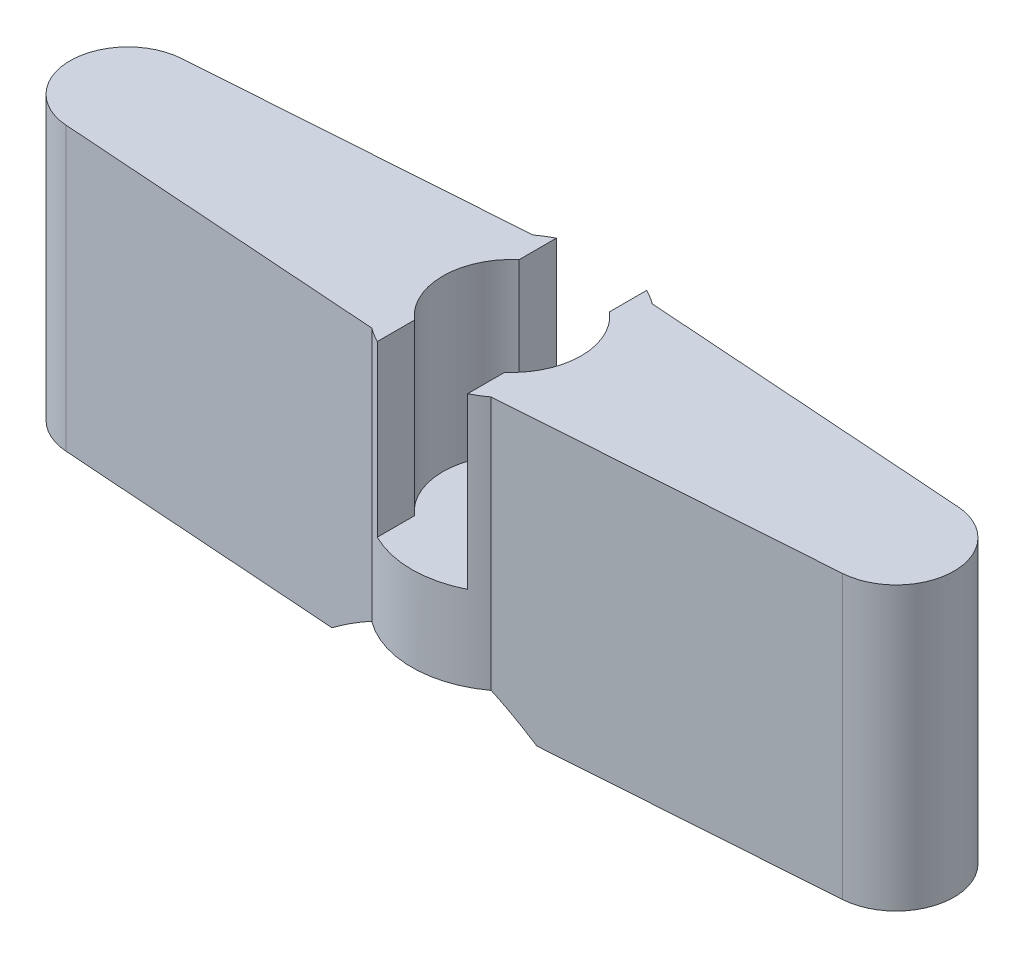
from build123d import *

# Parameters (mm, degrees)
BOSS_EXTRUDE1_DEPTH = 10
CUT_EXTRUDE1_DEPTH  = 1
CHAMFER1_SIZE       = 1
CUT_EXTRUDE2_DEPTH  = 6


with BuildPart() as part:
    # Sketch2 → Boss-Extrude1 (new body)
    with BuildSketch(Plane(origin=(0, 0, 0), x_dir=(1, 0, 0), z_dir=(0, 1, 0))):
        with BuildLine():
            Line((-13.742133053, -2.045066795), (-2.112067201, -2.853361551))
            ThreePointArc((-2.112067201, -2.853361551), (0, -3.55), (2.112067201, -2.853361551))
            Line((2.112067201, -2.853361551), (13.742133053, -2.045066795))
            ThreePointArc((13.742133053, -2.045066795), (15.65, 0), (13.742133053, 2.045066795))
            Line((13.742133053, 2.045066795), (2.112067201, 2.853361551))
            ThreePointArc((2.112067201, 2.853361551), (0, 3.55), (-2.112067201, 2.853361551))
            Line((-2.112067201, 2.853361551), (-13.742133053, 2.045066795))
            ThreePointArc((-13.742133053, 2.045066795), (-15.65, 0), (-13.742133053, -2.045066795))
        make_face()
    extrude(amount=BOSS_EXTRUDE1_DEPTH)

    # Sketch3 → Cut-Extrude1 (cut)
    with BuildSketch(Plane.XZ):
        with BuildLine():
            ThreePointArc((-2.112067201, 2.853361551), (0, -3.55), (2.112067201, 2.853361551))
            ThreePointArc((2.112067201, 2.853361551), (0, 3.55), (-2.112067201, 2.853361551))
        make_face()
    extrude(amount=-CUT_EXTRUDE1_DEPTH, mode=Mode.SUBTRACT)

    # Chamfer1
    chamfer1_edges = [part.edges().sort_by_distance(p)[0] for p in [
        (3.55, 0, 0),
        (-3.55, 0, 0),
    ]]
    chamfer(chamfer1_edges, length=CHAMFER1_SIZE - 0.0001)  # a hair under: the kernel refuses the full size

    # Shaft Key → Cut-Extrude2 (cut)
    with BuildSketch(Plane(origin=(0, 10, 0), x_dir=(1, 0, 0), z_dir=(0, 1, 0))):
        with BuildLine():
            Line((1.6, -1.855397532), (1.6, -5.45))
            Line((1.6, -5.45), (-1.6, -5.45))
            Line((-1.6, -5.45), (-1.6, -1.855397532))
            ThreePointArc((-1.6, -1.855397532), (-2.45, 0), (-1.6, 1.855397532))
            Line((-1.6, 1.855397532), (-1.6, 5.45))
            Line((-1.6, 5.45), (1.6, 5.45))
            Line((1.6, 5.45), (1.6, 1.855397532))
            ThreePointArc((1.6, 1.855397532), (2.45, 0), (1.6, -1.855397532))
        make_face()
    extrude(amount=-CUT_EXTRUDE2_DEPTH, mode=Mode.SUBTRACT)


solid = part.part
